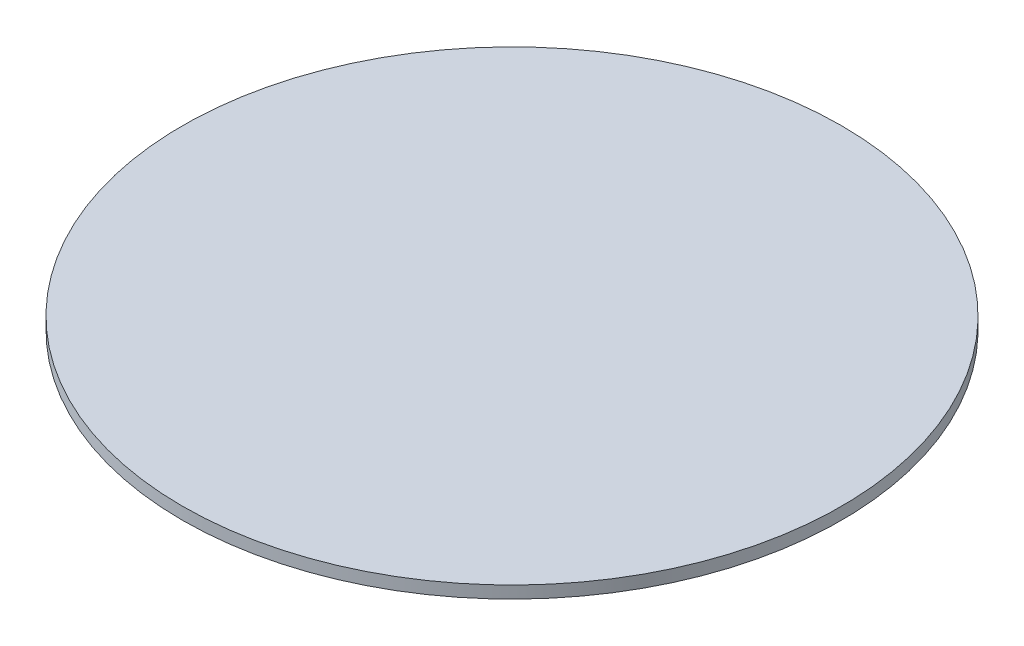
from build123d import *

# Parameters (mm, degrees)
SKETCH2_R           = 13.5
BOSS_EXTRUDE1_DEPTH = 0.5


with BuildPart() as part:
    # Sketch2 → Boss-Extrude1 (new body)
    with BuildSketch(Plane(origin=(0, 0, 0), x_dir=(1, 0, 0), z_dir=(0, 1, 0))):
        Circle(SKETCH2_R)
    extrude(amount=BOSS_EXTRUDE1_DEPTH)


solid = part.part
